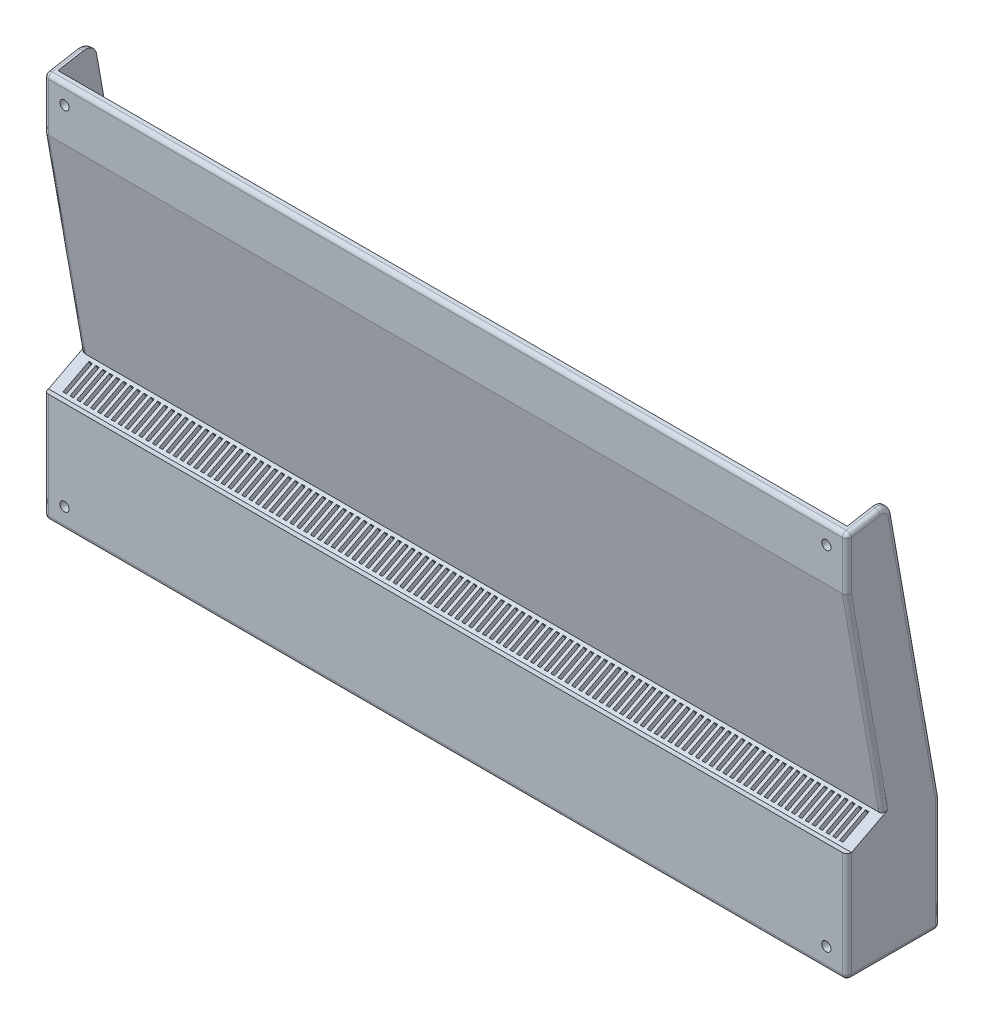
from build123d import *

# Parameters (mm, degrees)
EXTRUDE_B_DEPTH     = 344.541094252
EXTRUDE_L_DEPTH     = 3
EXTRUDE_START       = 3
EXTRUDE_R_DEPTH     = 3
FILLET1_R           = 2
FILLET2_R           = 2
HOLES_R             = 2
CUT_EXTRUDE1_DEPTH  = 6.5
CUT_EXTRUDE2_REACH  = 368.238
BOSS_EXTRUDE1_DEPTH = 92.5
BOSS_EXTRUDE2_START = -112.856094252
BOSS_EXTRUDE2_DEPTH = 344.541094252
SKETCH10_W          = 1.5
SKETCH10_H          = 12.750326625
CUT_EXTRUDE3_DEPTH  = 2.662907676


with BuildPart() as part:
    # bottomplate → Extrude B (new body)
    with BuildSketch(Plane(origin=(231.685, 0, 0), x_dir=(0, 0, -1), z_dir=(1, 0, 0))):
        Polygon((0, -72.093199774), (-3.140077856, -72.093199774), (-3.140077856, 96.641538376), (0, 97.195218823), align=None)
    extrude(amount=-EXTRUDE_B_DEPTH)

    # leftside → Extrude L (add)
    with BuildSketch(Plane.ZY.offset(112.856094252)):
        with BuildLine():
            Line((3.140077856, -72.093199774), (-35.506086159, -72.093199774))
            ThreePointArc((-35.506086159, -72.093199774), (-36.920299721, -71.507413337), (-37.506086159, -70.093199774))
            Line((-37.506086159, -70.093199774), (-37.506086159, -22.093199774))
            Line((-37.506086159, -22.093199774), (-16.843859154, 95.088112592))
            ThreePointArc((-16.843859154, 95.088112592), (-14.787702571, 98.315631925), (-11.051579501, 99.143910469))
            Line((-11.051579501, 99.143910469), (3.140077856, 96.641538376))
            Line((3.140077856, 96.641538376), (3.140077856, -72.093199774))
        make_face()
    extrude(amount=EXTRUDE_L_DEPTH)

    # rightside → Extrude R (add)
    with BuildSketch(Plane(origin=(231.685, 0, 0), x_dir=(0, 0, -1), z_dir=(1, 0, 0)).offset(EXTRUDE_START)):
        with BuildLine():
            Line((-3.140077856, -72.093199774), (35.506086159, -72.093199774))
            ThreePointArc((35.506086159, -72.093199774), (36.920299721, -71.507413337), (37.506086159, -70.093199774))
            Line((37.506086159, -70.093199774), (37.506086159, -22.093199774))
            Line((37.506086159, -22.093199774), (16.843859154, 95.088112592))
            ThreePointArc((16.843859154, 95.088112592), (14.787702571, 98.315631925), (11.051579501, 99.143910469))
            Line((11.051579501, 99.143910469), (-3.140077856, 96.641538376))
            Line((-3.140077856, 96.641538376), (-3.140077856, -72.093199774))
        make_face()
    extrude(amount=-EXTRUDE_R_DEPTH)

    # Fillet1
    fillet1_edges = [part.edges().sort_by_distance(p)[0] for p in [
        (59.414452874, 96.641538376, 3.140077856),
        (59.414452874, -72.093199774, 3.140077856),
    ]]
    fillet(fillet1_edges, radius=FILLET1_R)

    # Fillet2
    fillet2_edges = [part.edges().sort_by_distance(p)[0] for p in [
        (-115.856094252, 98.315631925, -14.787702571),
        (-115.856094252, 36.497456409, -27.174972657),
        (-115.856094252, -46.093199774, -37.506086159),
        (-115.856094252, -71.507413337, -36.920299721),
        (-115.856094252, -72.093199774, -17.183004152),
        (234.685, -71.507413337, -36.920299721),
        (234.685, -46.093199774, -37.506086159),
        (234.685, 36.497456409, -27.174972657),
        (234.685, 98.315631925, -14.787702571),
        (234.685, 98.038432544, -4.782102645),
        (-115.856094252, 12.43506967, 3.140077856),
        (234.685, 12.43506967, 3.140077856),
        (234.685, -72.093199774, -17.183004152),
        (234.685, 96.248914333, 2.672166742),
        (234.685, -71.507413337, 2.554291418),
        (-115.856094252, 98.038432544, -4.782102645),
        (-115.856094252, 96.248914333, 2.672166742),
        (-115.856094252, -71.507413337, 2.554291418),
    ]]
    fillet(fillet2_edges, radius=FILLET2_R)

    # holes → Cut-Extrude1 (cut)
    with BuildSketch(Plane.XY.offset(3.140077856)):
        with Locations((225.685, -63.093199774)):
            Circle(HOLES_R)
        with Locations((225.685, 88.669883521)):
            Circle(HOLES_R)
        with Locations((-106.856094252, 88.669883521)):
            Circle(HOLES_R)
        with Locations((-106.856094252, -63.093199774)):
            Circle(HOLES_R)
    extrude(amount=-CUT_EXTRUDE1_DEPTH, mode=Mode.SUBTRACT)

    # Cut-Extrude2: up to this face of the body (flat: up to its plane)
    cut_extrude2_end = Plane(part.part.faces().sort_by_distance((234.685, 1.936662769, -14.297045609))[0])
    # Sketch3 → Cut-Extrude2 (cut, up to the picked face)
    with BuildSketch(Plane.ZY.offset(115.856094252), mode=Mode.PRIVATE) as cut_extrude2_sk1:
        Polygon((-16.969700288, -14.701570936), (-1.366913064, 73.786232586), (6.334986919, 73.786232586), (6.334986919, -24.097748016), (1.140077856, -24.097748016), align=None)
    cut_extrude2_tool1 = split(extrude(cut_extrude2_sk1.sketch, amount=-CUT_EXTRUDE2_REACH, mode=Mode.PRIVATE), bisect_by=cut_extrude2_end, keep=Keep.BOTH, mode=Mode.PRIVATE)
    add(cut_extrude2_tool1.solids().sort_by(Axis((-115.856094, 18.517418, -2.04231), (1, 0, 0)))[0], mode=Mode.SUBTRACT)

    # Sketch7 → Boss-Extrude1 (add, along a direction that is not the sketch's normal)
    with BuildSketch(Plane.XZ.offset(-73.786232586)):
        with BuildLine():
            Line((-112.856094252, -1.366913064), (-115.856094252, -1.366913064))
            Line((-115.856094252, -1.366913064), (-115.856094252, 1.140077856))
            ThreePointArc((-115.856094252, 1.140077856), (-115.270307814, 2.554291418), (-113.856094252, 3.140077856))
            Line((-113.856094252, 3.140077856), (232.685, 3.140077856))
            ThreePointArc((232.685, 3.140077856), (234.099213562, 2.554291418), (234.685, 1.140077856))
            Line((234.685, 1.140077856), (234.685, -1.366913064))
            Line((234.685, -1.366913064), (231.685, -1.366913064))
            Line((231.685, -1.366913064), (231.685, 0))
            Line((231.685, 0), (-112.856094252, 0))
            Line((-112.856094252, 0), (-112.856094252, -1.366913064))
        make_face()
    extrude(amount=BOSS_EXTRUDE1_DEPTH, dir=(0, -0.9848077530122087, -0.17364817766692703))

    # Boss-Extrude2: read off the stored shape, not the designer's step
    # Boss-Extrude2 outline → Boss-Extrude2 (add)
    with BuildSketch(Plane.YZ.offset(BOSS_EXTRUDE2_START)):
        Polygon((-16.84399971, -12.840477366), (-23.506223739, 0), (-26.506223739, 0), (-18.099887666, -16.202002153), (-17.308484568, -16.062456434), (-17.308484568, -12.922378578), align=None)
    extrude(amount=BOSS_EXTRUDE2_DEPTH)

    # Sketch10 → Cut-Extrude3 (cut)
    with BuildSketch(Plane(origin=(0, -18.520494368, -9.609275349), x_dir=(1, 0, 0), z_dir=(0, 0.8876358918964163, 0.46054589718860106))):
        with Locations((-110.106094252, -4.234929693)):
            Rectangle(SKETCH10_W, SKETCH10_H)
        with Locations((-107.106094252, -4.234929693)):
            Rectangle(SKETCH10_W, SKETCH10_H)
        with Locations((-104.106094252, -4.234929693)):
            Rectangle(SKETCH10_W, SKETCH10_H)
        with Locations((-101.106094252, -4.234929693)):
            Rectangle(SKETCH10_W, SKETCH10_H)
        with Locations((-98.106094252, -4.234929693)):
            Rectangle(SKETCH10_W, SKETCH10_H)
        with Locations((-95.106094252, -4.234929693)):
            Rectangle(SKETCH10_W, SKETCH10_H)
        with Locations((-92.106094252, -4.234929693)):
            Rectangle(SKETCH10_W, SKETCH10_H)
        with Locations((-89.106094252, -4.234929693)):
            Rectangle(SKETCH10_W, SKETCH10_H)
        with Locations((-86.106094252, -4.234929693)):
            Rectangle(SKETCH10_W, SKETCH10_H)
        with Locations((-83.106094252, -4.234929693)):
            Rectangle(SKETCH10_W, SKETCH10_H)
        with Locations((-80.106094252, -4.234929693)):
            Rectangle(SKETCH10_W, SKETCH10_H)
        with Locations((-77.106094252, -4.234929693)):
            Rectangle(SKETCH10_W, SKETCH10_H)
        with Locations((-74.106094252, -4.234929693)):
            Rectangle(SKETCH10_W, SKETCH10_H)
        with Locations((-71.106094252, -4.234929693)):
            Rectangle(SKETCH10_W, SKETCH10_H)
        with Locations((-68.106094252, -4.234929693)):
            Rectangle(SKETCH10_W, SKETCH10_H)
        with Locations((-65.106094252, -4.234929693)):
            Rectangle(SKETCH10_W, SKETCH10_H)
        with Locations((-62.106094252, -4.234929693)):
            Rectangle(SKETCH10_W, SKETCH10_H)
        with Locations((-59.106094252, -4.234929693)):
            Rectangle(SKETCH10_W, SKETCH10_H)
        with Locations((-56.106094252, -4.234929693)):
            Rectangle(SKETCH10_W, SKETCH10_H)
        with Locations((-53.106094252, -4.234929693)):
            Rectangle(SKETCH10_W, SKETCH10_H)
        with Locations((-50.106094252, -4.234929693)):
            Rectangle(SKETCH10_W, SKETCH10_H)
        with Locations((-47.106094252, -4.234929693)):
            Rectangle(SKETCH10_W, SKETCH10_H)
        with Locations((-44.106094252, -4.234929693)):
            Rectangle(SKETCH10_W, SKETCH10_H)
        with Locations((-41.106094252, -4.234929693)):
            Rectangle(SKETCH10_W, SKETCH10_H)
        with Locations((-38.106094252, -4.234929693)):
            Rectangle(SKETCH10_W, SKETCH10_H)
        with Locations((-35.106094252, -4.234929693)):
            Rectangle(SKETCH10_W, SKETCH10_H)
        with Locations((-32.106094252, -4.234929693)):
            Rectangle(SKETCH10_W, SKETCH10_H)
        with Locations((-29.106094252, -4.234929693)):
            Rectangle(SKETCH10_W, SKETCH10_H)
        with Locations((-26.106094252, -4.234929693)):
            Rectangle(SKETCH10_W, SKETCH10_H)
        with Locations((-23.106094252, -4.234929693)):
            Rectangle(SKETCH10_W, SKETCH10_H)
        with Locations((-20.106094252, -4.234929693)):
            Rectangle(SKETCH10_W, SKETCH10_H)
        with Locations((-17.106094252, -4.234929693)):
            Rectangle(SKETCH10_W, SKETCH10_H)
        with Locations((-14.106094252, -4.234929693)):
            Rectangle(SKETCH10_W, SKETCH10_H)
        with Locations((-11.106094252, -4.234929693)):
            Rectangle(SKETCH10_W, SKETCH10_H)
        with Locations((-8.106094252, -4.234929693)):
            Rectangle(SKETCH10_W, SKETCH10_H)
        with Locations((-5.106094252, -4.234929693)):
            Rectangle(SKETCH10_W, SKETCH10_H)
        with Locations((-2.106094252, -4.234929693)):
            Rectangle(SKETCH10_W, SKETCH10_H)
        with Locations((0.893905748, -4.234929693)):
            Rectangle(SKETCH10_W, SKETCH10_H)
        with Locations((3.893905748, -4.234929693)):
            Rectangle(SKETCH10_W, SKETCH10_H)
        with Locations((6.893905748, -4.234929693)):
            Rectangle(SKETCH10_W, SKETCH10_H)
        with Locations((9.893905748, -4.234929693)):
            Rectangle(SKETCH10_W, SKETCH10_H)
        with Locations((12.893905748, -4.234929693)):
            Rectangle(SKETCH10_W, SKETCH10_H)
        with Locations((15.893905748, -4.234929693)):
            Rectangle(SKETCH10_W, SKETCH10_H)
        with Locations((18.893905748, -4.234929693)):
            Rectangle(SKETCH10_W, SKETCH10_H)
        with Locations((21.893905748, -4.234929693)):
            Rectangle(SKETCH10_W, SKETCH10_H)
        with Locations((24.893905748, -4.234929693)):
            Rectangle(SKETCH10_W, SKETCH10_H)
        with Locations((27.893905748, -4.234929693)):
            Rectangle(SKETCH10_W, SKETCH10_H)
        with Locations((30.893905748, -4.234929693)):
            Rectangle(SKETCH10_W, SKETCH10_H)
        with Locations((33.893905748, -4.234929693)):
            Rectangle(SKETCH10_W, SKETCH10_H)
        with Locations((36.893905748, -4.234929693)):
            Rectangle(SKETCH10_W, SKETCH10_H)
        with Locations((39.893905748, -4.234929693)):
            Rectangle(SKETCH10_W, SKETCH10_H)
        with Locations((42.893905748, -4.234929693)):
            Rectangle(SKETCH10_W, SKETCH10_H)
        with Locations((45.893905748, -4.234929693)):
            Rectangle(SKETCH10_W, SKETCH10_H)
        with Locations((48.893905748, -4.234929693)):
            Rectangle(SKETCH10_W, SKETCH10_H)
        with Locations((51.893905748, -4.234929693)):
            Rectangle(SKETCH10_W, SKETCH10_H)
        with Locations((54.893905748, -4.234929693)):
            Rectangle(SKETCH10_W, SKETCH10_H)
        with Locations((57.893905748, -4.234929693)):
            Rectangle(SKETCH10_W, SKETCH10_H)
        with Locations((60.893905748, -4.234929693)):
            Rectangle(SKETCH10_W, SKETCH10_H)
        with Locations((63.893905748, -4.234929693)):
            Rectangle(SKETCH10_W, SKETCH10_H)
        with Locations((66.893905748, -4.234929693)):
            Rectangle(SKETCH10_W, SKETCH10_H)
        with Locations((69.893905748, -4.234929693)):
            Rectangle(SKETCH10_W, SKETCH10_H)
        with Locations((72.893905748, -4.234929693)):
            Rectangle(SKETCH10_W, SKETCH10_H)
        with Locations((75.893905748, -4.234929693)):
            Rectangle(SKETCH10_W, SKETCH10_H)
        with Locations((78.893905748, -4.234929693)):
            Rectangle(SKETCH10_W, SKETCH10_H)
        with Locations((81.893905748, -4.234929693)):
            Rectangle(SKETCH10_W, SKETCH10_H)
        with Locations((84.893905748, -4.234929693)):
            Rectangle(SKETCH10_W, SKETCH10_H)
        with Locations((87.893905748, -4.234929693)):
            Rectangle(SKETCH10_W, SKETCH10_H)
        with Locations((90.893905748, -4.234929693)):
            Rectangle(SKETCH10_W, SKETCH10_H)
        with Locations((93.893905748, -4.234929693)):
            Rectangle(SKETCH10_W, SKETCH10_H)
        with Locations((96.893905748, -4.234929693)):
            Rectangle(SKETCH10_W, SKETCH10_H)
        with Locations((99.893905748, -4.234929693)):
            Rectangle(SKETCH10_W, SKETCH10_H)
        with Locations((102.893905748, -4.234929693)):
            Rectangle(SKETCH10_W, SKETCH10_H)
        with Locations((105.893905748, -4.234929693)):
            Rectangle(SKETCH10_W, SKETCH10_H)
        with Locations((108.893905748, -4.234929693)):
            Rectangle(SKETCH10_W, SKETCH10_H)
        with Locations((111.893905748, -4.234929693)):
            Rectangle(SKETCH10_W, SKETCH10_H)
        with Locations((114.893905748, -4.234929693)):
            Rectangle(SKETCH10_W, SKETCH10_H)
        with Locations((117.893905748, -4.234929693)):
            Rectangle(SKETCH10_W, SKETCH10_H)
        with Locations((120.893905748, -4.234929693)):
            Rectangle(SKETCH10_W, SKETCH10_H)
        with Locations((123.893905748, -4.234929693)):
            Rectangle(SKETCH10_W, SKETCH10_H)
        with Locations((126.893905748, -4.234929693)):
            Rectangle(SKETCH10_W, SKETCH10_H)
        with Locations((129.893905748, -4.234929693)):
            Rectangle(SKETCH10_W, SKETCH10_H)
        with Locations((132.893905748, -4.234929693)):
            Rectangle(SKETCH10_W, SKETCH10_H)
        with Locations((135.893905748, -4.234929693)):
            Rectangle(SKETCH10_W, SKETCH10_H)
        with Locations((138.893905748, -4.234929693)):
            Rectangle(SKETCH10_W, SKETCH10_H)
        with Locations((141.893905748, -4.234929693)):
            Rectangle(SKETCH10_W, SKETCH10_H)
        with Locations((144.893905748, -4.234929693)):
            Rectangle(SKETCH10_W, SKETCH10_H)
        with Locations((147.893905748, -4.234929693)):
            Rectangle(SKETCH10_W, SKETCH10_H)
        with Locations((150.893905748, -4.234929693)):
            Rectangle(SKETCH10_W, SKETCH10_H)
        with Locations((153.893905748, -4.234929693)):
            Rectangle(SKETCH10_W, SKETCH10_H)
        with Locations((156.893905748, -4.234929693)):
            Rectangle(SKETCH10_W, SKETCH10_H)
        with Locations((159.893905748, -4.234929693)):
            Rectangle(SKETCH10_W, SKETCH10_H)
        with Locations((162.893905748, -4.234929693)):
            Rectangle(SKETCH10_W, SKETCH10_H)
        with Locations((165.893905748, -4.234929693)):
            Rectangle(SKETCH10_W, SKETCH10_H)
        with Locations((168.893905748, -4.234929693)):
            Rectangle(SKETCH10_W, SKETCH10_H)
        with Locations((171.893905748, -4.234929693)):
            Rectangle(SKETCH10_W, SKETCH10_H)
        with Locations((174.893905748, -4.234929693)):
            Rectangle(SKETCH10_W, SKETCH10_H)
        with Locations((177.893905748, -4.234929693)):
            Rectangle(SKETCH10_W, SKETCH10_H)
        with Locations((180.893905748, -4.234929693)):
            Rectangle(SKETCH10_W, SKETCH10_H)
        with Locations((183.893905748, -4.234929693)):
            Rectangle(SKETCH10_W, SKETCH10_H)
        with Locations((186.893905748, -4.234929693)):
            Rectangle(SKETCH10_W, SKETCH10_H)
        with Locations((189.893905748, -4.234929693)):
            Rectangle(SKETCH10_W, SKETCH10_H)
        with Locations((192.893905748, -4.234929693)):
            Rectangle(SKETCH10_W, SKETCH10_H)
        with Locations((195.893905748, -4.234929693)):
            Rectangle(SKETCH10_W, SKETCH10_H)
        with Locations((198.893905748, -4.234929693)):
            Rectangle(SKETCH10_W, SKETCH10_H)
        with Locations((201.893905748, -4.234929693)):
            Rectangle(SKETCH10_W, SKETCH10_H)
        with Locations((204.893905748, -4.234929693)):
            Rectangle(SKETCH10_W, SKETCH10_H)
        with Locations((207.893905748, -4.234929693)):
            Rectangle(SKETCH10_W, SKETCH10_H)
        with Locations((210.893905748, -4.234929693)):
            Rectangle(SKETCH10_W, SKETCH10_H)
        with Locations((213.893905748, -4.234929693)):
            Rectangle(SKETCH10_W, SKETCH10_H)
        with Locations((216.893905748, -4.234929693)):
            Rectangle(SKETCH10_W, SKETCH10_H)
        with Locations((219.893905748, -4.234929693)):
            Rectangle(SKETCH10_W, SKETCH10_H)
        with Locations((222.893905748, -4.234929693)):
            Rectangle(SKETCH10_W, SKETCH10_H)
        with Locations((225.893905748, -4.234929693)):
            Rectangle(SKETCH10_W, SKETCH10_H)
        with Locations((228.893905748, -4.234929693)):
            Rectangle(SKETCH10_W, SKETCH10_H)
    extrude(amount=-CUT_EXTRUDE3_DEPTH, mode=Mode.SUBTRACT)


solid = part.part
